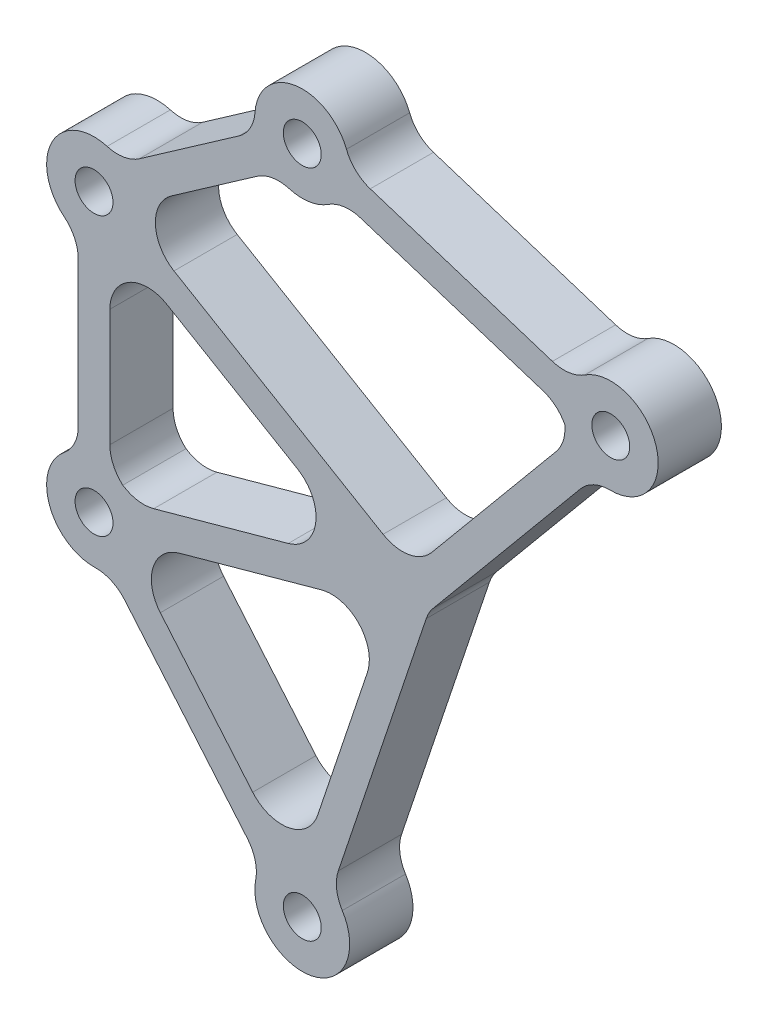
from build123d import *

# Parameters (mm, degrees)
SKETCH1_R           = 4.7625
SKETCH1_R_2         = 1.905
BOSS_EXTRUDE1_DEPTH = 6.35
FILLET1_R           = 3.81
FILLET2_R           = 3.81


with BuildPart() as part:
    # Sketch1 → Boss-Extrude1 (new body)
    # profile 1 of 10: a face of its own
    with BuildSketch(Plane.XY):
        with Locations((106.189208713, 23.71)):
            Circle(SKETCH1_R)
        with Locations((106.189208713, 23.71)):
            Circle(SKETCH1_R_2, mode=Mode.SUBTRACT)
    # profile 2 of 10: a face of its own
    with BuildSketch(Plane.XY):
        with BuildLine():
            Line((87.880964772, -0.786362752), (104.53862394, 19.242676846))
            ThreePointArc((104.53862394, 19.242676846), (103.143914747, 20.048362263), (102.097532116, 21.272872823))
            Line((102.097532116, 21.272872823), (86.113888675, 2.054264483))
            Line((86.113888675, 2.054264483), (58.96261429, 18.093110387))
            ThreePointArc((58.96261429, 18.093110387), (58.389707875, 16.587746324), (57.347778506, 15.359444279))
            Line((57.347778506, 15.359444279), (82.443811077, 0.534674233))
            Line((82.443811077, 0.534674233), (58.194514032, -6.164197988))
            ThreePointArc((58.194514032, -6.164197988), (58.832358657, -7.4612961), (59.051708713, -8.89))
            ThreePointArc((59.051708713, -8.89), (59.048766191, -9.057388361), (59.039942261, -9.224569879))
            Line((59.039942261, -9.224569879), (84.017242402, -2.324586685))
            Line((84.017242402, -2.324586685), (75.126101157, -28.865420044))
            ThreePointArc((75.126101157, -28.865420044), (76.717900747, -29.111421646), (78.136663259, -29.873954045))
            Line((78.136663259, -29.873954045), (87.880964772, -0.786362752))
        make_face()
    # profile 3 of 10: a face of its own
    with BuildSketch(Plane.XY):
        with BuildLine():
            ThreePointArc((101.428860996, 23.566836206), (101.65338858, 25.161806453), (102.396731965, 26.590716294))
            Line((102.396731965, 26.590716294), (79.965447461, 33.770428593))
            ThreePointArc((79.965447461, 33.770428593), (79.967061643, 33.698854784), (79.967599745, 33.627264799))
            ThreePointArc((79.967599745, 33.627264799), (79.718583807, 32.107439852), (78.997576492, 30.746548504))
            Line((78.997576492, 30.746548504), (101.428860996, 23.566836206))
        make_face()
    # profile 4 of 10: a face of its own
    with BuildSketch(Plane.XY):
        with Locations((75.205099745, 33.627264799)):
            Circle(SKETCH1_R)
        with Locations((75.205099745, 33.627264799)):
            Circle(SKETCH1_R_2, mode=Mode.SUBTRACT)
    # profile 5 of 10: a face of its own
    with BuildSketch(Plane.XY):
        with BuildLine():
            ThreePointArc((72.434047253, 29.753936212), (71.301416872, 30.89913975), (70.615297221, 32.356391461))
            Line((70.615297221, 32.356391461), (57.060261204, 22.883328587))
            ThreePointArc((57.060261204, 22.883328587), (58.192891585, 21.738125049), (58.879011236, 20.280873338))
            Line((58.879011236, 20.280873338), (72.434047253, 29.753936212))
        make_face()
    # profile 6 of 10: a face of its own
    with BuildSketch(Plane.XY):
        with Locations((54.289208713, 19.01)):
            Circle(SKETCH1_R)
        with Locations((54.289208713, 19.01)):
            Circle(SKETCH1_R_2, mode=Mode.SUBTRACT)
    # profile 7 of 10: a face of its own
    with BuildSketch(Plane.XY):
        with BuildLine():
            ThreePointArc((55.876708713, 14.519871939), (54.289208713, 14.2475), (52.701708713, 14.519871939))
            Line((52.701708713, 14.519871939), (52.701708713, -4.399871939))
            ThreePointArc((52.701708713, -4.399871939), (54.289208713, -4.1275), (55.876708713, -4.399871939))
            Line((55.876708713, -4.399871939), (55.876708713, 14.519871939))
        make_face()
    # profile 8 of 10: a face of its own
    with BuildSketch(Plane.XY):
        with Locations((54.289208713, -8.89)):
            Circle(SKETCH1_R)
        with Locations((54.289208713, -8.89)):
            Circle(SKETCH1_R_2, mode=Mode.SUBTRACT)
    # profile 9 of 10: a face of its own
    with BuildSketch(Plane.XY):
        with BuildLine():
            ThreePointArc((58.400562122, -11.29378439), (57.364168417, -12.526760793), (55.976054927, -13.343757526))
            Line((55.976054927, -13.343757526), (71.093746335, -31.223480409))
            ThreePointArc((71.093746335, -31.223480409), (72.13014004, -29.990504006), (73.518253531, -29.173507273))
            Line((73.518253531, -29.173507273), (58.400562122, -11.29378439))
        make_face()
    # profile 10 of 10: a face of its own
    with BuildSketch(Plane.XY):
        with Locations((75.205099745, -33.627264799)):
            Circle(SKETCH1_R)
        with Locations((75.205099745, -33.627264799)):
            Circle(SKETCH1_R_2, mode=Mode.SUBTRACT)
    extrude(amount=BOSS_EXTRUDE1_DEPTH)

    # Fillet1
    # the kernel refuses this fillet: 3.81 mm, written as the material it adds along each edge
    with BuildSketch(Plane(origin=(58.96261429, 18.093110387, 0), x_dir=(0.8609971993913142, -0.5086096957789081, 0), z_dir=(0, 0, 1)), Plane(origin=(75.126101157, -28.865420044, 0), x_dir=(0.31764850444110154, 0.9482085359383406, 0), z_dir=(0, 0, 1)), Plane(origin=(79.965447461, 33.770428593, 0), x_dir=(0.9524031774112249, -0.30484124992691375, 0), z_dir=(0, 0, 1)), Plane(origin=(104.53862394, 19.242676846, 0), x_dir=(-0.6394318036990395, -0.7688478187640211, 0), z_dir=(0, 0, 1)), Plane(origin=(52.701708713, -4.399871939, 0), x_dir=(0, 1, 0), z_dir=(0, 0, 1)), Plane(origin=(57.060261204, 22.883328587, 0), x_dir=(0.8196709443644911, 0.572834655869059, 0), z_dir=(0, 0, 1))) as fillet1_piece_1:
        with BuildLine():
            CenterArc((2.169808125, 3.81), FILLET1_R, 219.022802565, 50.977197435)
            ThreePointArc((-0.790163513, 1.411111111), (-0.334744459, 0.739341932), (0, 0))
            Line((0, 0), (2.169808125, 0))
        make_face()
    extrude(amount=6.35)
    with BuildSketch(Plane(origin=(86.113888675, 2.054264483, 0), x_dir=(-0.8609971993913146, 0.5086096957789075, 0), z_dir=(0, 0, 1))) as fillet1_piece_2:
        with BuildLine():
            CenterArc((FILLET1_R * 0.85139484235, -FILLET1_R), FILLET1_R, 90, 80.821803005)
            Line((-FILLET1_R * 0.135802191515, -FILLET1_R * 0.840494463015), (0, 0))
            Line((0, 0), (FILLET1_R * 0.85139484235, 0))
        make_face()
    extrude(amount=6.35)
    with BuildSketch(Plane(origin=(102.097532116, 21.272872823, 0), x_dir=(-0.6394318036990395, -0.7688478187640211, 0), z_dir=(0, 0, 1)), Plane(origin=(78.997576492, 30.746548504, 0), x_dir=(0.9524031774112243, -0.3048412499269152, 0), z_dir=(0, 0, 1)), Plane(origin=(58.879011236, 20.280873338, 0), x_dir=(0.819670944364491, 0.5728346558690592, 0), z_dir=(0, 0, 1)), Plane(origin=(73.518253531, -29.173507273, 0), x_dir=(-0.6456608303485428, 0.7636243134903644, 0), z_dir=(0, 0, 1)), Plane(origin=(59.039942261, -9.224569879, 0), x_dir=(0.9638966585389959, 0.2662766074167205, 0), z_dir=(0, 0, 1)), Plane(origin=(57.347778506, 15.359444279, 0), x_dir=(0.8609971993913154, -0.5086096957789064, 0), z_dir=(0, 0, 1))) as fillet1_piece_3:
        with BuildLine():
            CenterArc((2.169808125, -3.81), FILLET1_R, 90, 50.977197435)
            ThreePointArc((-0.790163513, -1.411111111), (-0.334744459, -0.739341932), (0, 0))
            Line((0, 0), (2.169808125, 0))
        make_face()
    extrude(amount=6.35)
    with BuildSketch(Plane(origin=(101.428860996, 23.566836206, 0), x_dir=(0.19934053923435113, -0.9799302778349887, 0), z_dir=(0, 0, 1)), Plane(origin=(72.434047253, 29.753936212, 0), x_dir=(0.9002818811258162, -0.4353074023222692, 0), z_dir=(0, 0, 1)), Plane(origin=(58.400562122, -11.29378439, 0), x_dir=(0.3508244107521176, 0.9364412596743211, 0), z_dir=(0, 0, 1)), Plane(origin=(58.194514032, -6.164197988, 0), x_dir=(-0.7032685796981372, 0.7109242609514496, 0), z_dir=(0, 0, 1)), Plane(origin=(55.876708713, 14.519871939, 0), x_dir=(0.8725214911102023, 0.48857573369010987, 0), z_dir=(0, 0, 1)), Plane(origin=(71.093746335, -31.223480409, 0), x_dir=(-0.3508244107521106, -0.9364412596743238, 0), z_dir=(0, 0, 1))) as fillet1_piece_4:
        with BuildLine():
            CenterArc((2.264191284, -3.754677766), FILLET1_R, 99.775790965, 50.977197435)
            Line((-1.060115597, -1.893204221), (0, 0))
            ThreePointArc((0, 0), (0.808639744, -0.069152792), (1.617279489, 0))
        make_face()
    extrude(amount=6.35)
    with BuildSketch(Plane(origin=(84.017242402, -2.324586685, 0), x_dir=(-0.3176485044411025, -0.9482085359383404, 0), z_dir=(0, 0, 1))) as fillet1_piece_5:
        with BuildLine():
            CenterArc((FILLET1_R * 1.8792860539, -FILLET1_R), FILLET1_R, 90, 123.963598679)
            Line((FILLET1_R * 1.04989338062, -FILLET1_R * 1.55866608409), (0, 0))
            Line((0, 0), (FILLET1_R * 1.8792860539, 0))
        make_face()
    extrude(amount=6.35)
    with BuildSketch(Plane(origin=(55.876708713, -4.399871939, 0), x_dir=(0.8725214911102017, -0.488575733690111, 0), z_dir=(0, 0, 1)), Plane(origin=(70.615297221, 32.356391461, 0), x_dir=(-0.09933921507111794, 0.9950536268709613, 0), z_dir=(0, 0, 1)), Plane(origin=(102.396731965, 26.590716294, 0), x_dir=(0.7313016231106118, 0.682054203150882, 0), z_dir=(0, 0, 1)), Plane(origin=(78.136663259, -29.873954045, 0), x_dir=(0.6721369745474647, -0.740426827881176, 0), z_dir=(0, 0, 1)), Plane(origin=(55.976054927, -13.343757526, 0), x_dir=(-0.9817328385571232, -0.1902646412199953, 0), z_dir=(0, 0, 1)), Plane(origin=(52.701708713, 14.519871939, 0), x_dir=(-0.8725214911102018, 0.48857573369011076, 0), z_dir=(0, 0, 1))) as fillet1_piece_6:
        with BuildLine():
            CenterArc((2.264191284, 3.754677766), FILLET1_R, 209.2470116, 50.977197435)
            Line((-1.060115597, 1.893204221), (0, 0))
            ThreePointArc((0, 0), (0.808639744, 0.069152792), (1.617279489, 0))
        make_face()
    extrude(amount=6.35)
    with BuildSketch(Plane(origin=(82.443811077, 0.534674233, 0), x_dir=(-0.9638966585389961, -0.2662766074167203, 0), z_dir=(0, 0, 1))) as fillet1_piece_7:
        with BuildLine():
            CenterArc((FILLET1_R * 2.35504725068, -FILLET1_R), FILLET1_R, 90, 133.985910602)
            Line((FILLET1_R * 1.63553665117, -FILLET1_R * 1.69448145921), (0, 0))
            Line((0, 0), (FILLET1_R * 2.35504725068, 0))
        make_face()
    extrude(amount=6.35)
    with BuildSketch(Plane(origin=(87.880964772, -0.786362752, 0), x_dir=(-0.3176485044411054, -0.9482085359383393, 0), z_dir=(0, 0, 1))) as fillet1_piece_8:
        with BuildLine():
            CenterArc((FILLET1_R * 0.187404040861, FILLET1_R), FILLET1_R, 248.771312287, 21.228687713)
            Line((-FILLET1_R * 0.174687293783, FILLET1_R * 0.0678573792733), (0, 0))
            Line((0, 0), (FILLET1_R * 0.187404040861, 0))
        make_face()
    extrude(amount=6.35)

    # Fillet2
    fillet2_edges = [part.edges().sort_by_distance(p)[0] for p in [
        (74.278682032, -28.792470042, 3.175),
        (59.113584062, 19.194358415, 3.175),
        (58.904928759, -10.316241556, 3.175),
        (56.72342156, 14.744855925, 3.175),
    ]]
    fillet(fillet2_edges, radius=FILLET2_R)


solid = part.part
